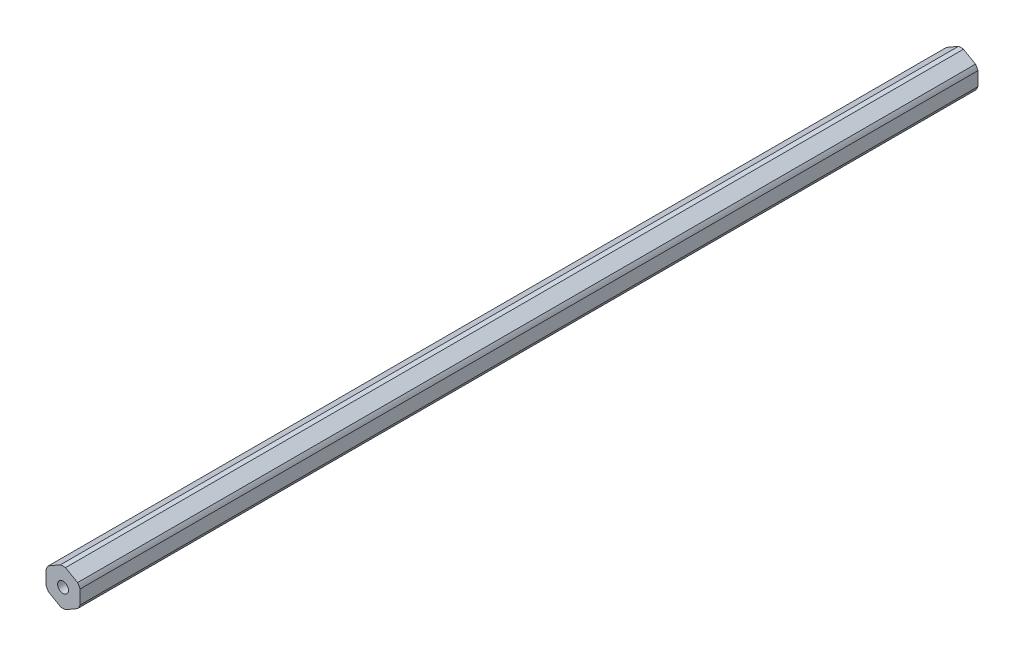
from build123d import *

# Parameters (mm, degrees)
BOSS_EXTRUDE1_DEPTH                  = 167.48125
F_10_32_TAPPED_HOLE1_D               = 4.0386
F_10_32_TAPPED_HOLE1_DEPTH           = 16.34744
F_10_32_TAPPED_HOLE1_TIP             = 1.213317848
F_10_32_TAPPED_HOLE1_ON_FACE_2_D     = 4.0386
F_10_32_TAPPED_HOLE1_ON_FACE_2_DEPTH = 16.34744
F_10_32_TAPPED_HOLE1_ON_FACE_2_TIP   = 1.213317848


with BuildPart() as part:
    # Sketch1 → Boss-Extrude1 (new, symmetric)
    with BuildSketch(Plane.XY):
        with BuildLine():
            ThreePointArc((0.93173274, 6.79441227), (0, 6.858), (-0.93173274, 6.79441227))
            Line((-0.93173274, 6.79441227), (-5.41826726, 4.204110358))
            ThreePointArc((-5.41826726, 4.204110358), (-5.939202219, 3.429), (-6.35, 2.590301913))
            Line((-6.35, 2.590301913), (-6.35, -2.590301913))
            ThreePointArc((-6.35, -2.590301913), (-5.939202219, -3.429), (-5.41826726, -4.204110358))
            Line((-5.41826726, -4.204110358), (-0.93173274, -6.79441227))
            ThreePointArc((-0.93173274, -6.79441227), (0, -6.858), (0.93173274, -6.79441227))
            Line((0.93173274, -6.79441227), (5.41826726, -4.204110358))
            ThreePointArc((5.41826726, -4.204110358), (5.939202219, -3.429), (6.35, -2.590301913))
            Line((6.35, -2.590301913), (6.35, 2.590301913))
            ThreePointArc((6.35, 2.590301913), (5.939202219, 3.429), (5.41826726, 4.204110358))
            Line((5.41826726, 4.204110358), (0.93173274, 6.79441227))
        make_face()
    extrude(amount=BOSS_EXTRUDE1_DEPTH, both=True)

    # #10-32 Tapped Hole1
    with Locations(Plane.XY.offset(167.48125)):
        with Locations((0, 0)):
            Hole(F_10_32_TAPPED_HOLE1_D / 2, depth=F_10_32_TAPPED_HOLE1_DEPTH)
            with Locations((0, 0, -(F_10_32_TAPPED_HOLE1_DEPTH + F_10_32_TAPPED_HOLE1_TIP / 2))):  # 118° drill point
                Cone(0, F_10_32_TAPPED_HOLE1_D / 2, F_10_32_TAPPED_HOLE1_TIP, mode=Mode.SUBTRACT)

    # #10-32 Tapped Hole1 on face 2
    with Locations(Plane(origin=(0, 0, -167.48125), x_dir=(-1, 0, 0), z_dir=(0, 0, -1))):
        with Locations((0, 0)):
            Hole(F_10_32_TAPPED_HOLE1_ON_FACE_2_D / 2, depth=F_10_32_TAPPED_HOLE1_ON_FACE_2_DEPTH)
            with Locations((0, 0, -(F_10_32_TAPPED_HOLE1_ON_FACE_2_DEPTH + F_10_32_TAPPED_HOLE1_ON_FACE_2_TIP / 2))):  # 118° drill point
                Cone(0, F_10_32_TAPPED_HOLE1_ON_FACE_2_D / 2, F_10_32_TAPPED_HOLE1_ON_FACE_2_TIP, mode=Mode.SUBTRACT)


solid = part.part
